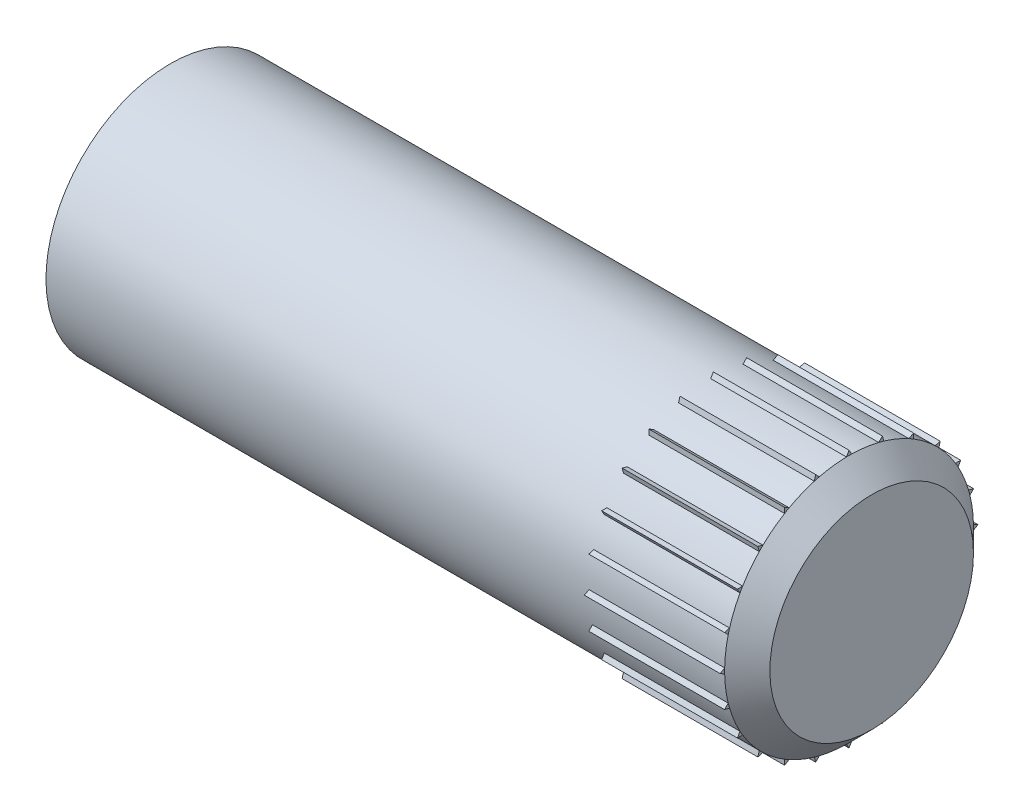
from build123d import *

# Parameters (mm, degrees)
SKETCH1_R           = 2.75
BOSS_EXTRUDE1_DEPTH = 15.5
CHAMFER1_SIZE       = 0.5
BOSS_EXTRUDE2_START = -3
BOSS_EXTRUDE2_DEPTH = 3
CIRPATTERN1_START   = 12
CIRPATTERN1_DEPTH   = 3


# Read off the part's stored shape, not the designer's step: CirPattern1
with BuildPart() as part:
    # Sketch1 → Boss-Extrude1 (new body)
    with BuildSketch(Plane(origin=(0, 0, 0), x_dir=(0, 0, -1), z_dir=(1, 0, 0))):
        Circle(SKETCH1_R)
    extrude(amount=BOSS_EXTRUDE1_DEPTH)

    # Chamfer1
    chamfer1_edges = [part.edges().sort_by_distance(p)[0] for p in [
        (15.5, 0, 2.75),
    ]]
    chamfer(chamfer1_edges, length=CHAMFER1_SIZE)

    # Sketch2 → Boss-Extrude2 (add)
    with BuildSketch(Plane(origin=(15, 0, 0), x_dir=(0, 0, -1), z_dir=(1, 0, 0)).offset(BOSS_EXTRUDE2_START)):
        with BuildLine():
            Line((0, 2.85), (-0.058089283, 2.749386411))
            ThreePointArc((-0.058089283, 2.749386411), (0, 2.75), (0.058089283, 2.749386411))
            Line((0.058089283, 2.749386411), (0, 2.85))
        make_face()
    extrude(amount=BOSS_EXTRUDE2_DEPTH)

    # CirPattern1 outline → CirPattern1 (add)
    with BuildSketch(Plane.YZ.offset(CIRPATTERN1_START)):
        with BuildLine():
            Line((-1.425, -2.351993835), (-1.425, -2.468172401))
            Line((-1.425, -2.468172401), (-1.324386411, -2.410083118))
            ThreePointArc((-1.324386411, -2.410083118), (-1.375, -2.38156986), (-1.425, -2.351993835))
        make_face()
        with BuildLine():
            ThreePointArc((-0.655483627, -2.670737953), (-0.711752374, -2.656296022), (-0.767703504, -2.640668728))
            Line((-0.767703504, -2.640668728), (-0.737634279, -2.752888605))
            Line((-0.737634279, -2.752888605), (-0.655483627, -2.670737953))
        make_face()
        with BuildLine():
            Line((-2.015254326, -2.015254326), (-1.903034449, -1.985185101))
            ThreePointArc((-1.903034449, -1.985185101), (-1.944543648, -1.944543648), (-1.985185101, -1.903034449))
            Line((-1.985185101, -1.903034449), (-2.015254326, -2.015254326))
        make_face()
        with BuildLine():
            ThreePointArc((0.058089283, -2.749386411), (0, -2.75), (-0.058089283, -2.749386411))
            Line((-0.058089283, -2.749386411), (0, -2.85))
            Line((0, -2.85), (0.058089283, -2.749386411))
        make_face()
        with BuildLine():
            Line((-2.468172401, -1.425), (-2.351993835, -1.425))
            ThreePointArc((-2.351993835, -1.425), (-2.38156986, -1.375), (-2.410083118, -1.324386411))
            Line((-2.410083118, -1.324386411), (-2.468172401, -1.425))
        make_face()
        with BuildLine():
            ThreePointArc((0.767703504, -2.640668728), (0.711752374, -2.656296022), (0.655483627, -2.670737953))
            Line((0.655483627, -2.670737953), (0.737634279, -2.752888605))
            Line((0.737634279, -2.752888605), (0.767703504, -2.640668728))
        make_face()
        with BuildLine():
            Line((-2.752888605, -0.737634279), (-2.640668728, -0.767703504))
            ThreePointArc((-2.640668728, -0.767703504), (-2.656296022, -0.711752374), (-2.670737953, -0.655483627))
            Line((-2.670737953, -0.655483627), (-2.752888605, -0.737634279))
        make_face()
        with BuildLine():
            ThreePointArc((1.425, -2.351993835), (1.375, -2.38156986), (1.324386411, -2.410083118))
            Line((1.324386411, -2.410083118), (1.425, -2.468172401))
            Line((1.425, -2.468172401), (1.425, -2.351993835))
        make_face()
        with BuildLine():
            Line((-2.85, 0), (-2.749386411, -0.058089283))
            ThreePointArc((-2.749386411, -0.058089283), (-2.75, 0), (-2.749386411, 0.058089283))
            Line((-2.749386411, 0.058089283), (-2.85, 0))
        make_face()
        with BuildLine():
            ThreePointArc((1.985185101, -1.903034449), (1.944543648, -1.944543648), (1.903034449, -1.985185101))
            Line((1.903034449, -1.985185101), (2.015254326, -2.015254326))
            Line((2.015254326, -2.015254326), (1.985185101, -1.903034449))
        make_face()
        with BuildLine():
            Line((-2.752888605, 0.737634279), (-2.670737953, 0.655483627))
            ThreePointArc((-2.670737953, 0.655483627), (-2.656296022, 0.711752374), (-2.640668728, 0.767703504))
            Line((-2.640668728, 0.767703504), (-2.752888605, 0.737634279))
        make_face()
        with BuildLine():
            ThreePointArc((2.410083118, -1.324386411), (2.38156986, -1.375), (2.351993835, -1.425))
            Line((2.351993835, -1.425), (2.468172401, -1.425))
            Line((2.468172401, -1.425), (2.410083118, -1.324386411))
        make_face()
        with BuildLine():
            Line((-2.468172401, 1.425), (-2.410083118, 1.324386411))
            ThreePointArc((-2.410083118, 1.324386411), (-2.38156986, 1.375), (-2.351993835, 1.425))
            Line((-2.351993835, 1.425), (-2.468172401, 1.425))
        make_face()
        with BuildLine():
            ThreePointArc((2.670737953, -0.655483627), (2.656296022, -0.711752374), (2.640668728, -0.767703504))
            Line((2.640668728, -0.767703504), (2.752888605, -0.737634279))
            Line((2.752888605, -0.737634279), (2.670737953, -0.655483627))
        make_face()
        with BuildLine():
            Line((-2.015254326, 2.015254326), (-1.985185101, 1.903034449))
            ThreePointArc((-1.985185101, 1.903034449), (-1.944543648, 1.944543648), (-1.903034449, 1.985185101))
            Line((-1.903034449, 1.985185101), (-2.015254326, 2.015254326))
        make_face()
        with BuildLine():
            Line((-1.425, 2.468172401), (-1.425, 2.351993835))
            ThreePointArc((-1.425, 2.351993835), (-1.375, 2.38156986), (-1.324386411, 2.410083118))
            Line((-1.324386411, 2.410083118), (-1.425, 2.468172401))
        make_face()
        with BuildLine():
            ThreePointArc((2.640668728, 0.767703504), (2.656296022, 0.711752374), (2.670737953, 0.655483627))
            Line((2.670737953, 0.655483627), (2.752888605, 0.737634279))
            Line((2.752888605, 0.737634279), (2.640668728, 0.767703504))
        make_face()
        with BuildLine():
            Line((-0.737634279, 2.752888605), (-0.767703504, 2.640668728))
            ThreePointArc((-0.767703504, 2.640668728), (-0.711752374, 2.656296022), (-0.655483627, 2.670737953))
            Line((-0.655483627, 2.670737953), (-0.737634279, 2.752888605))
        make_face()
        with BuildLine():
            ThreePointArc((2.351993835, 1.425), (2.38156986, 1.375), (2.410083118, 1.324386411))
            Line((2.410083118, 1.324386411), (2.468172401, 1.425))
            Line((2.468172401, 1.425), (2.351993835, 1.425))
        make_face()
        with BuildLine():
            Line((0, 2.85), (-0.058089283, 2.749386411))
            ThreePointArc((-0.058089283, 2.749386411), (0, 2.75), (0.058089283, 2.749386411))
            Line((0.058089283, 2.749386411), (0, 2.85))
        make_face()
        with BuildLine():
            ThreePointArc((1.903034449, 1.985185101), (1.944543648, 1.944543648), (1.985185101, 1.903034449))
            Line((1.985185101, 1.903034449), (2.015254326, 2.015254326))
            Line((2.015254326, 2.015254326), (1.903034449, 1.985185101))
        make_face()
        with BuildLine():
            Line((0.737634279, 2.752888605), (0.655483627, 2.670737953))
            ThreePointArc((0.655483627, 2.670737953), (0.711752374, 2.656296022), (0.767703504, 2.640668728))
            Line((0.767703504, 2.640668728), (0.737634279, 2.752888605))
        make_face()
        with BuildLine():
            ThreePointArc((1.324386411, 2.410083118), (1.375, 2.38156986), (1.425, 2.351993835))
            Line((1.425, 2.351993835), (1.425, 2.468172401))
            Line((1.425, 2.468172401), (1.324386411, 2.410083118))
        make_face()
    extrude(amount=CIRPATTERN1_DEPTH)


solid = part.part
